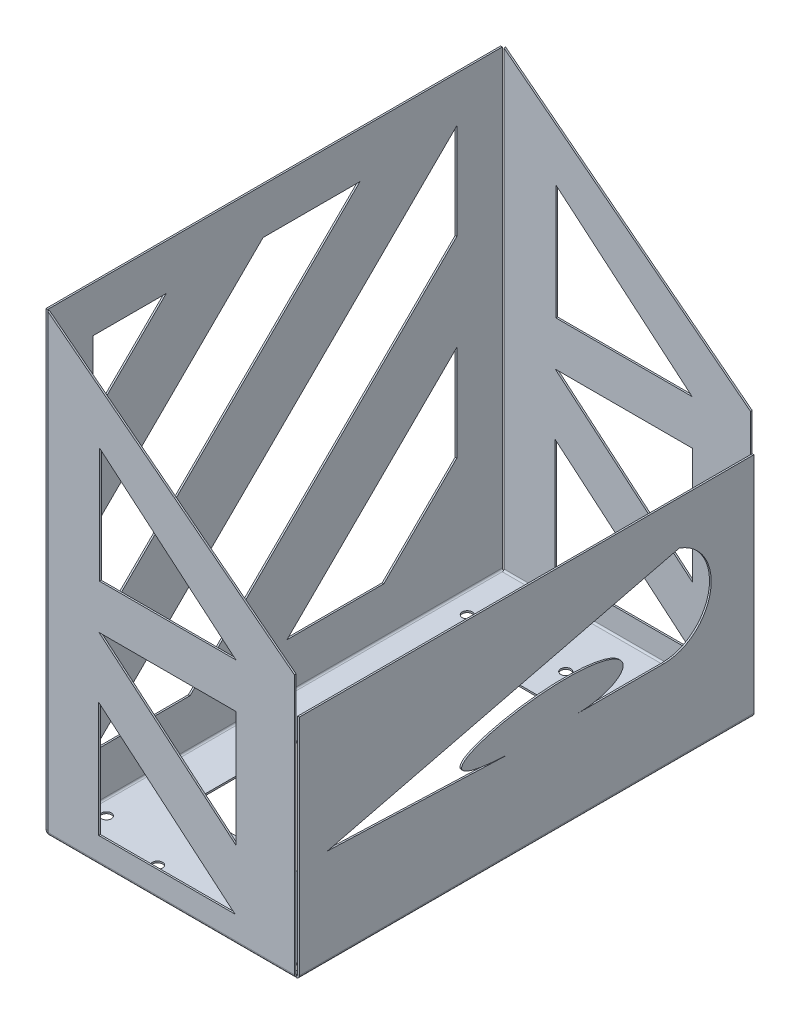
from build123d import *

# Parameters (mm, degrees)
SKETCH1_W                    = 110
SKETCH1_H                    = 200
SKETCH1_W_2                  = 70
SKETCH1_H_2                  = 120
BASE_FLANGE1_DEPTH           = 0.7366
EDGE_FLANGE1_STRIP_W         = 4.4196
EDGE_FLANGE1_STRIP_H         = 0.7366
EDGE_FLANGE1_STRIP_CUT_DEPTH = 200
EDGE_FLANGE1_DEPTH           = 200
EDGE_FLANGE2_STRIP_W         = 4.4196
EDGE_FLANGE2_STRIP_H         = 0.7366
EDGE_FLANGE2_STRIP_CUT_DEPTH = 200
EDGE_FLANGE2_DEPTH           = 200
EDGE_FLANGE3_STRIP_W         = 4.4196
EDGE_FLANGE3_STRIP_H         = 0.7366
EDGE_FLANGE3_STRIP_CUT_DEPTH = 108.5268
EDGE_FLANGE3_DEPTH           = 108.5268
EDGE_FLANGE3_START           = 0.7366
EDGE_FLANGE3_FLAT_DEPTH      = 0.7366
EDGE_FLANGE4_STRIP_W         = 4.4196
EDGE_FLANGE4_STRIP_H         = 0.7366
EDGE_FLANGE4_STRIP_CUT_DEPTH = 108.5268
EDGE_FLANGE4_DEPTH           = 108.5268
EDGE_FLANGE4_START           = 0.7366
EDGE_FLANGE4_FLAT_DEPTH      = 0.7366
CUT_EXTRUDE2_DEPTH           = 289.797370967
CUT_EXTRUDE3_START           = -0.7366
CUT_EXTRUDE3_DEPTH           = 0.7366
CUT_EXTRUDE6_DEPTH           = 800.082459726
CUT_EXTRUDE6_DEPTH_BACK      = 800.082459726
SKETCH53_R                   = 2.2
SKETCH53_R_2                 = 2.199999998
CUT_EXTRUDE7_DEPTH           = 10


# Read off the part's stored shape, not the designer's step: Cut-Extrude3
# Sheet-metal steps are written as plain solids
with BuildPart() as part:
    # Sketch1 → Base-Flange1 (new body)
    with BuildSketch(Plane(origin=(0, 0, 0), x_dir=(1, 0, 0), z_dir=(0, 1, 0))):
        Rectangle(SKETCH1_W, SKETCH1_H)
        Rectangle(SKETCH1_W_2, SKETCH1_H_2, mode=Mode.SUBTRACT)
    extrude(amount=-BASE_FLANGE1_DEPTH)

    # Edge-Flange1 strip (across the edge) → Edge-Flange1 strip cut (cut)
    with BuildSketch(Plane(origin=(-55, 0, -100), x_dir=(1, 0, 0), z_dir=(0, 0, 1))):
        with Locations((-1.4732, -0.3683)):
            Rectangle(EDGE_FLANGE1_STRIP_W, EDGE_FLANGE1_STRIP_H)
    extrude(amount=EDGE_FLANGE1_STRIP_CUT_DEPTH, mode=Mode.SUBTRACT)

    # Edge-Flange1 section (across the edge) → Edge-Flange1 (add)
    with BuildSketch(Plane(origin=(-55, 0, -100), x_dir=(1, 0, 0), z_dir=(0, 0, 1))):
        with BuildLine():
            Line((-0.7366, 0.7366), (-0.7366, 199.2634))
            Line((-0.7366, 199.2634), (0, 199.2634))
            Line((0, 199.2634), (0, 0.7366))
            ThreePointArc((0, 0.7366), (0.215745145, 0.215745145), (0.7366, 0))
            Line((0.7366, 0), (0.7366, -0.7366))
            ThreePointArc((0.7366, -0.7366), (-0.30510971, -0.30510971), (-0.7366, 0.7366))
        make_face()
    extrude(amount=EDGE_FLANGE1_DEPTH)

    # Edge-Flange2 strip (across the edge) → Edge-Flange2 strip cut (cut)
    with BuildSketch(Plane(origin=(55, 0, 100), x_dir=(-1, 0, 0), z_dir=(0, 0, -1))):
        with Locations((-1.4732, -0.3683)):
            Rectangle(EDGE_FLANGE2_STRIP_W, EDGE_FLANGE2_STRIP_H)
    extrude(amount=EDGE_FLANGE2_STRIP_CUT_DEPTH, mode=Mode.SUBTRACT)

    # Edge-Flange2 section (across the edge) → Edge-Flange2 (add)
    with BuildSketch(Plane(origin=(55, 0, 100), x_dir=(-1, 0, 0), z_dir=(0, 0, -1))):
        with BuildLine():
            Line((-0.7366, 0.7366), (-0.7366, 99.2634))
            Line((-0.7366, 99.2634), (0, 99.2634))
            Line((0, 99.2634), (0, 0.7366))
            ThreePointArc((0, 0.7366), (0.215745145, 0.215745145), (0.7366, 0))
            Line((0.7366, 0), (0.7366, -0.7366))
            ThreePointArc((0.7366, -0.7366), (-0.30510971, -0.30510971), (-0.7366, 0.7366))
        make_face()
    extrude(amount=EDGE_FLANGE2_DEPTH)

    # Edge-Flange3 strip (across the edge) → Edge-Flange3 strip cut (cut)
    with BuildSketch(Plane(origin=(54.2634, 0, -100), x_dir=(0, 0, 1), z_dir=(-1, 0, 0))):
        with Locations((-1.4732, -0.3683)):
            Rectangle(EDGE_FLANGE3_STRIP_W, EDGE_FLANGE3_STRIP_H)
    extrude(amount=EDGE_FLANGE3_STRIP_CUT_DEPTH, mode=Mode.SUBTRACT)

    # Edge-Flange3 bend section (across the edge) → Edge-Flange3 (add)
    with BuildSketch(Plane(origin=(54.2634, 0, -100), x_dir=(0, 0, 1), z_dir=(-1, 0, 0))):
        with BuildLine():
            Line((-0.7366, 0.7366), (0, 0.7366))
            ThreePointArc((0, 0.7366), (0.215745145, 0.215745145), (0.7366, 0))
            Line((0.7366, 0), (0.7366, -0.7366))
            ThreePointArc((0.7366, -0.7366), (-0.30510971, -0.30510971), (-0.7366, 0.7366))
        make_face()
    extrude(amount=EDGE_FLANGE3_DEPTH)

    # Edge-Flange3 profile (on flange) → Edge-Flange3 flat (add)
    with BuildSketch(Plane(origin=(0, 0, -100), x_dir=(-1, 0, 0), z_dir=(0, 0, -1)).offset(EDGE_FLANGE3_START)):
        Polygon((-54.2634, 115), (-54.2634, 0.7366), (54.2634, 0.7366), (54.2634, 199.2634), align=None)
    extrude(amount=-EDGE_FLANGE3_FLAT_DEPTH)

    # Edge-Flange4 strip (across the edge) → Edge-Flange4 strip cut (cut)
    with BuildSketch(Plane(origin=(-54.2634, 0, 100), x_dir=(0, 0, -1), z_dir=(1, 0, 0))):
        with Locations((-1.4732, -0.3683)):
            Rectangle(EDGE_FLANGE4_STRIP_W, EDGE_FLANGE4_STRIP_H)
    extrude(amount=EDGE_FLANGE4_STRIP_CUT_DEPTH, mode=Mode.SUBTRACT)

    # Edge-Flange4 bend section (across the edge) → Edge-Flange4 (add)
    with BuildSketch(Plane(origin=(-54.2634, 0, 100), x_dir=(0, 0, -1), z_dir=(1, 0, 0))):
        with BuildLine():
            Line((-0.7366, 0.7366), (0, 0.7366))
            ThreePointArc((0, 0.7366), (0.215745145, 0.215745145), (0.7366, 0))
            Line((0.7366, 0), (0.7366, -0.7366))
            ThreePointArc((0.7366, -0.7366), (-0.30510971, -0.30510971), (-0.7366, 0.7366))
        make_face()
    extrude(amount=EDGE_FLANGE4_DEPTH)

    # Edge-Flange4 profile (on flange) → Edge-Flange4 flat (add)
    with BuildSketch(Plane.XY.offset(100).offset(EDGE_FLANGE4_START)):
        Polygon((-54.2634, 199.2634), (-54.2634, 0.7366), (54.2634, 0.7366), (54.2634, 115), align=None)
    extrude(amount=-EDGE_FLANGE4_FLAT_DEPTH)

    # Sketch24 → Cut-Extrude2 (cut, through all)
    with BuildSketch(Plane(origin=(0, 0, -100.7366), x_dir=(-1, 0, 0), z_dir=(0, 0, -1))):
        Polygon((-28.519875042, 107.808063094), (31.460124178, 107.808063094), (31.460124178, 158.533542729), align=None)
        Polygon((-28.150641863, 10.732953924), (31.829357358, 10.732953924), (31.829357358, 61.45843356), align=None)
        Polygon((31.713150602, 88.173102361), (-28.636081798, 88.173102361), (-28.636081798, 37.135359798), align=None)
    extrude(amount=-CUT_EXTRUDE2_DEPTH, mode=Mode.SUBTRACT)

    # Cut-Extrude3 outline → Cut-Extrude3 (cut)
    with BuildSketch(Plane(origin=(55.7366, 0, 0), x_dir=(0, 0, -1), z_dir=(1, 0, 0)).offset(CUT_EXTRUDE3_START)):
        with BuildLine():
            Line((-87.713422796, 42.053472661), (-6.797155753, 39.040000774))
            add(Edge.make_bspline(
                [(-6.797155753, 39.040000774), (-87.713422796, 42.053472661), (67.110125935, 80.068334048), (60.312641059, 39.424036929), (22.052524279, 39.424036929)],
                knots=[0, 0, 0, 0, 0, 1, 1, 1, 1, 1], degree=4))
            Line((22.052524279, 39.424036929), (60.312641059, 39.424036929))
            ThreePointArc((60.312641059, 39.424036929), (80.917037974, 56.86865569), (67.110125935, 80.068334048))
            Line((67.110125935, 80.068334048), (-87.713422796, 42.053472661))
        make_face()
    extrude(amount=CUT_EXTRUDE3_DEPTH, mode=Mode.SUBTRACT)

    # Sketch53 → Cut-Extrude6 (cut, two sides: drawn at the far end of the back side and taken through both)
    with BuildSketch(Plane(origin=(344.115063699, 0, 561.793038506), x_dir=(-1, 0, 0), z_dir=(0, 1, 0)).offset(-CUT_EXTRUDE6_DEPTH_BACK)):
        with Locations(Location((392.463649434, -480.956438506, 0), (0, 0, 90))):
            Circle(SKETCH53_R)
        with Locations(Location((392.463649434, -465.956438506, 0), (0, 0, 90))):
            Circle(SKETCH53_R)
        with Locations(Location((362.463649434, -473.456438506, 0), (0, 0, 90))):
            Circle(SKETCH53_R)
        with Locations(Location((292.463649434, -480.956438506, 0), (0, 0, 90))):
            Circle(SKETCH53_R)
        with Locations(Location((292.463649434, -465.956438506, 0), (0, 0, 90))):
            Circle(SKETCH53_R)
        with Locations(Location((322.463649434, -473.456438506, 0), (0, 0, 90))):
            Circle(SKETCH53_R)
        with Locations(Location((294.03158687, -636.983238506, 0), (0, 0, 90))):
            Circle(SKETCH53_R_2)
        with Locations(Location((324.69158687, -646.983238506, 0), (0, 0, 90))):
            Circle(SKETCH53_R_2)
        with Locations(Location((346.36158687, -636.983238506, 0), (0, 0, 90))):
            Circle(SKETCH53_R_2)
        with Locations(Location((368.028253537, -646.983238506, 0), (0, 0, 90))):
            Circle(SKETCH53_R_2)
        with Locations(Location((389.694920203, -636.983238506, 0), (0, 0, 90))):
            Circle(SKETCH53_R_2)
    extrude(amount=CUT_EXTRUDE6_DEPTH + CUT_EXTRUDE6_DEPTH_BACK, mode=Mode.SUBTRACT)

    # Sketch54 → Cut-Extrude7 (cut)
    with BuildSketch(Plane.ZY.offset(55.7366)):
        Polygon((-37.376001553, 179.2634), (5.247996894, 179.2634), (80, 105.199675962), (80, 62.968137981), align=None)
        Polygon((-80, 179.2634), (-80, 137.031862019), (37.376001553, 20.7366), (80, 20.7366), align=None)
        Polygon((-47.87199534, 20.7366), (-5.247996894, 20.7366), (-80, 94.800324038), (-80, 52.568786057), align=None)
        Polygon((80, 179.2634), (80, 147.431213943), (47.87199534, 179.2634), align=None)
    extrude(amount=-CUT_EXTRUDE7_DEPTH, mode=Mode.SUBTRACT)


solid = part.part
